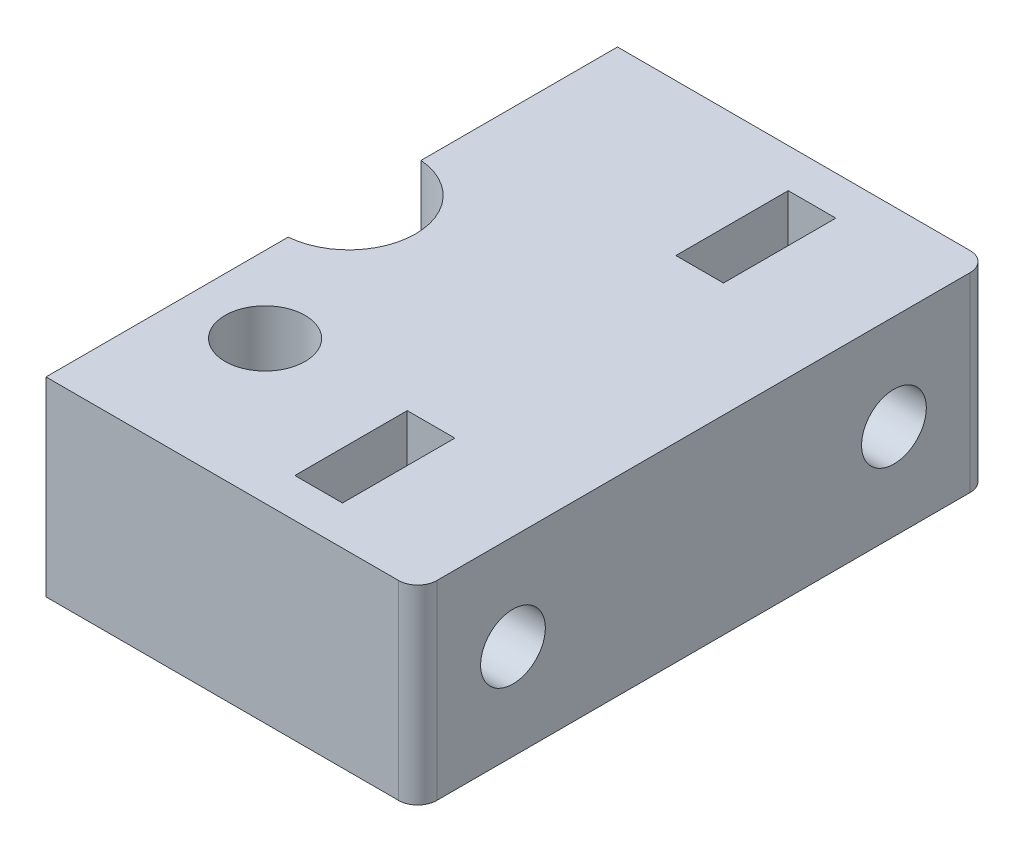
from build123d import *

# Parameters (mm, degrees)
SKETCH1_W           = 59.0272
SKETCH1_H           = 30
BOSS_EXTRUDE1_DEPTH = 10
SKETCH2_R           = 2.1
CUT_EXTRUDE1_DEPTH  = 35.58399319
SKETCH3_R           = 1.7
CUT_EXTRUDE2_DEPTH  = 12
SKETCH4_R           = 1.65
CUT_EXTRUDE3_DEPTH  = 12
CUT_EXTRUDE4_DEPTH  = 2.5
CUT_EXTRUDE5_DEPTH  = 2.3
SKETCH7_R           = 3.5
CUT_EXTRUDE6_DEPTH  = 35.58399319
FILLET1_R           = 1
SKETCH8_W           = 39.5136
SKETCH8_H           = 30
CUT_EXTRUDE7_DEPTH  = 35.58399319


with BuildPart() as part:
    # Sketch1 → Boss-Extrude1 (new body)
    with BuildSketch(Plane(origin=(0, 0, 0), x_dir=(1, 0, 0), z_dir=(0, 1, 0))):
        Rectangle(SKETCH1_W, SKETCH1_H)
    extrude(amount=BOSS_EXTRUDE1_DEPTH)

    # Sketch2 → Cut-Extrude1 (cut, through all)
    with BuildSketch(Plane(origin=(0, 10, 0), x_dir=(1, 0, 0), z_dir=(0, 1, 0))):
        with Locations((-6, -7.5)):
            Circle(SKETCH2_R)
        with Locations((14, -7.5)):
            Circle(SKETCH2_R)
    extrude(amount=-CUT_EXTRUDE1_DEPTH, mode=Mode.SUBTRACT)

    # Sketch3 → Cut-Extrude2 (cut)
    with BuildSketch(Plane(origin=(29.5136, 0, 0), x_dir=(0, 0, -1), z_dir=(1, 0, 0))):
        with Locations((-10, 5)):
            Circle(SKETCH3_R)
        with Locations((10, 5)):
            Circle(SKETCH3_R)
    extrude(amount=-CUT_EXTRUDE2_DEPTH, mode=Mode.SUBTRACT)

    # Sketch4 → Cut-Extrude3 (cut)
    with BuildSketch(Plane.ZY.offset(29.5136)):
        with Locations((-10, 5)):
            Circle(SKETCH4_R)
        with Locations((10, 5)):
            Circle(SKETCH4_R)
    extrude(amount=-CUT_EXTRUDE3_DEPTH, mode=Mode.SUBTRACT)

    # Sketch5 → Cut-Extrude4 (cut)
    with BuildSketch(Plane(origin=(23.5136, 0, 0), x_dir=(0, 0, -1), z_dir=(1, 0, 0))):
        Polygon((-12.95, 6.703183294), (-12.95, 10), (-7.05, 10), (-7.05, 6.703183294), (-7.05, 3.296816706), (-10, 1.593633412), (-12.95, 3.296816706), align=None)
        Polygon((7.05, 6.703183294), (7.05, 3.296816706), (10, 1.593633412), (12.95, 3.296816706), (12.95, 6.703183294), (12.95, 10), (7.05, 10), align=None)
    extrude(amount=-CUT_EXTRUDE4_DEPTH, mode=Mode.SUBTRACT)

    # Sketch6 → Cut-Extrude5 (cut)
    with BuildSketch(Plane.ZY.offset(23.5136)):
        Polygon((-12.85, 6.645448267), (-12.85, 10), (-7.15, 10), (-7.15, 6.645448267), (-7.15, 3.354551733), (-10, 1.709103466), (-12.85, 3.354551733), align=None)
        Polygon((7.15, 6.645448267), (7.15, 3.354551733), (10, 1.709103466), (12.85, 3.354551733), (12.85, 6.645448267), (12.85, 10), (7.15, 10), align=None)
    extrude(amount=-CUT_EXTRUDE5_DEPTH, mode=Mode.SUBTRACT)

    # Sketch7 → Cut-Extrude6 (cut, through all)
    with BuildSketch(Plane(origin=(0, 10, 0), x_dir=(1, 0, 0), z_dir=(0, 1, 0))):
        with Locations((9.7, 1.2)):
            Circle(SKETCH7_R)
        with Locations((-15.7, 1.2)):
            Circle(SKETCH7_R)
    extrude(amount=-CUT_EXTRUDE6_DEPTH, mode=Mode.SUBTRACT)

    # Fillet1
    fillet1_edges = [part.edges().sort_by_distance(p)[0] for p in [
        (29.5136, 5, -15),
        (29.5136, 5, 15),
        (-29.5136, 5, -15),
        (-29.5136, 5, 15),
    ]]
    fillet(fillet1_edges, radius=FILLET1_R)

    # Sketch8 → Cut-Extrude7 (cut, through all)
    with BuildSketch(Plane(origin=(0, 10, 0), x_dir=(1, 0, 0), z_dir=(0, 1, 0))):
        with Locations((-9.7568, 0)):
            Rectangle(SKETCH8_W, SKETCH8_H)
    extrude(amount=-CUT_EXTRUDE7_DEPTH, mode=Mode.SUBTRACT)


solid = part.part
